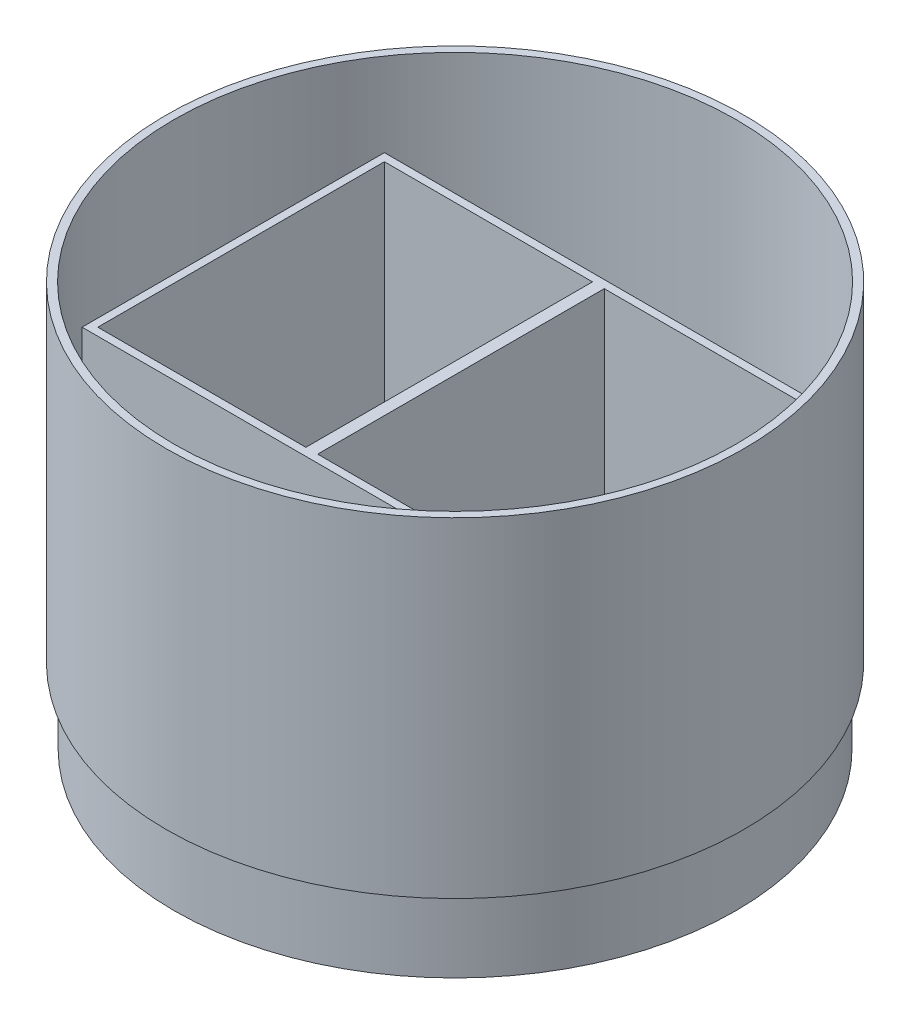
from build123d import *

# Parameters (mm, degrees)
SKETCH1_R           = 35.75
SKETCH1_R_2         = 34.75
BOSS_EXTRUDE1_DEPTH = 9.5
SKETCH3_R           = 34.75
BOSS_EXTRUDE2_DEPTH = 2
SKETCH4_W           = 28.5
SKETCH4_H           = 38.5
SKETCH4_W_2         = 26.5
SKETCH4_H_2         = 36.5
BOSS_EXTRUDE3_DEPTH = 40
SKETCH2_R           = 36.8
SKETCH2_R_2         = 34.75
BOSS_EXTRUDE4_DEPTH = 2
SKETCH5_R           = 36.8
SKETCH5_R_2         = 35.8
BOSS_EXTRUDE5_DEPTH = 40


with BuildPart() as part:
    # Sketch1 → Boss-Extrude1 (new body)
    with BuildSketch(Plane(origin=(0, 0, 0), x_dir=(1, 0, 0), z_dir=(0, 1, 0))):
        Circle(SKETCH1_R)
        Circle(SKETCH1_R_2, mode=Mode.SUBTRACT)
    extrude(amount=BOSS_EXTRUDE1_DEPTH)

    # Sketch3 → Boss-Extrude2 (add)
    with BuildSketch(Plane.XZ):
        Circle(SKETCH3_R)
    extrude(amount=-BOSS_EXTRUDE2_DEPTH)

    # Sketch4 → Boss-Extrude3 (add)
    with BuildSketch(Plane(origin=(0, 2, 0), x_dir=(1, 0, 0), z_dir=(0, 1, 0))):
        with Locations((-14, 0)):
            Rectangle(SKETCH4_W, SKETCH4_H)
        with Locations((-14, 0)):
            Rectangle(SKETCH4_W_2, SKETCH4_H_2, mode=Mode.SUBTRACT)
    boss_extrude3 = extrude(amount=BOSS_EXTRUDE3_DEPTH)

    # Mirror1: Boss-Extrude3 across plane
    add(boss_extrude3.mirror(Plane(origin=(0, 0, 0), x_dir=(0, 0, 1), z_dir=(1, 0, 0))))

    # Sketch2 → Boss-Extrude4 (add)
    with BuildSketch(Plane(origin=(0, 9.5, 0), x_dir=(1, 0, 0), z_dir=(0, 1, 0))):
        Circle(SKETCH2_R)
        Circle(SKETCH2_R_2, mode=Mode.SUBTRACT)
    extrude(amount=BOSS_EXTRUDE4_DEPTH)

    # Sketch5 → Boss-Extrude5 (add)
    with BuildSketch(Plane(origin=(0, 11.5, 0), x_dir=(1, 0, 0), z_dir=(0, 1, 0))):
        Circle(SKETCH5_R)
        Circle(SKETCH5_R_2, mode=Mode.SUBTRACT)
    extrude(amount=BOSS_EXTRUDE5_DEPTH)


solid = part.part
